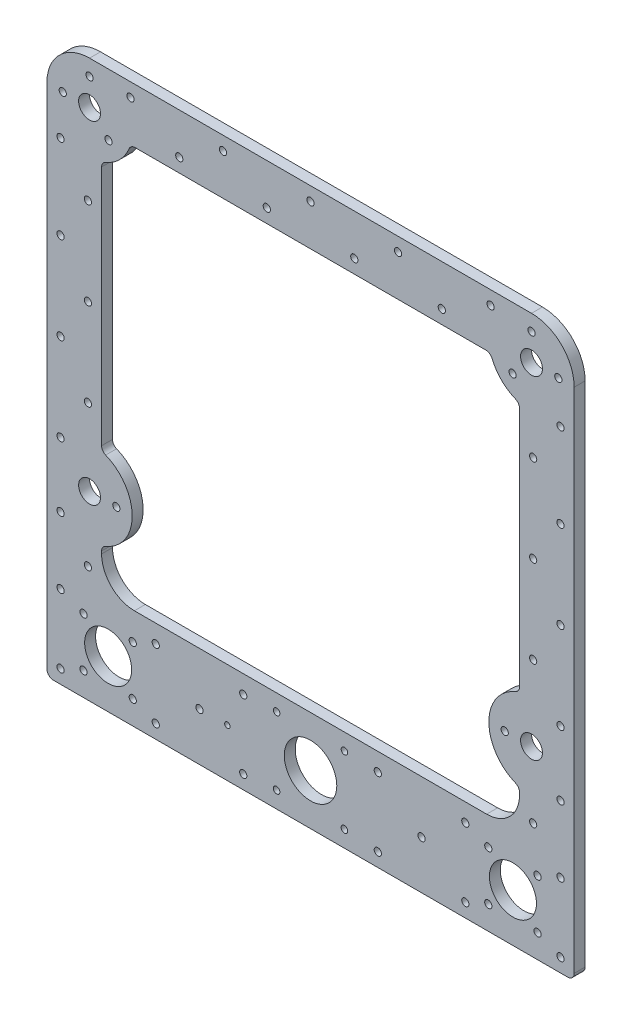
from build123d import *

# Parameters (mm, degrees)
CONVERT_SOLID1_START       = -5
CONVERT_SOLID1_OUTLINE_R   = 1.65
CONVERT_SOLID1_OUTLINE_R_2 = 10.75
CONVERT_SOLID1_OUTLINE_R_3 = 1.25
CONVERT_SOLID1_OUTLINE_R_4 = 1.5
CONVERT_SOLID1_OUTLINE_R_5 = 5
CONVERT_SOLID1_OUTLINE_R_6 = 12
CONVERT_SOLID1_DEPTH       = 5


# Read off the part's stored shape, not the designer's step: Convert-Solid1
with BuildPart() as part:
    # Convert-Solid1 outline → Convert-Solid1 (new body)
    with BuildSketch(Plane.XY.offset(CONVERT_SOLID1_START)):
        with BuildLine():
            ThreePointArc((19.5, 254.5), (5.711417767, 248.788582233), (0, 235))
            Line((0, 235), (0, 3))
            ThreePointArc((0, 3), (0.878679656, 0.878679656), (3, 0))
            Line((3, 0), (238, 0))
            ThreePointArc((238, 0), (240.121320344, 0.878679656), (241, 3))
            Line((241, 3), (241, 235))
            ThreePointArc((241, 235), (235.288582233, 248.788582233), (221.5, 254.5))
            Line((221.5, 254.5), (19.5, 254.5))
        make_face()
        with Locations((6.25, 6.25)):
            Circle(CONVERT_SOLID1_OUTLINE_R, mode=Mode.SUBTRACT)
        with Locations((16.75, 10.75)):
            Circle(CONVERT_SOLID1_OUTLINE_R, mode=Mode.SUBTRACT)
        with Locations((28, 22)):
            Circle(CONVERT_SOLID1_OUTLINE_R_2, mode=Mode.SUBTRACT)
        with Locations((39.25, 10.75)):
            Circle(CONVERT_SOLID1_OUTLINE_R, mode=Mode.SUBTRACT)
        with Locations((49.75, 6.25)):
            Circle(CONVERT_SOLID1_OUTLINE_R, mode=Mode.SUBTRACT)
        with Locations((6.25, 37.75)):
            Circle(CONVERT_SOLID1_OUTLINE_R, mode=Mode.SUBTRACT)
        with Locations((16.75, 33.25)):
            Circle(CONVERT_SOLID1_OUTLINE_R, mode=Mode.SUBTRACT)
        with Locations((18.75, 53)):
            Circle(CONVERT_SOLID1_OUTLINE_R, mode=Mode.SUBTRACT)
        with Locations((39.25, 33.25)):
            Circle(CONVERT_SOLID1_OUTLINE_R, mode=Mode.SUBTRACT)
        with Locations((49.75, 37.75)):
            Circle(CONVERT_SOLID1_OUTLINE_R, mode=Mode.SUBTRACT)
        with Locations((89.75, 6.25)):
            Circle(CONVERT_SOLID1_OUTLINE_R, mode=Mode.SUBTRACT)
        with Locations((69.75, 22)):
            Circle(CONVERT_SOLID1_OUTLINE_R, mode=Mode.SUBTRACT)
        with Locations((82.5, 22)):
            Circle(CONVERT_SOLID1_OUTLINE_R_3, mode=Mode.SUBTRACT)
        with Locations((105, 7.5)):
            Circle(CONVERT_SOLID1_OUTLINE_R_4, mode=Mode.SUBTRACT)
        with Locations((89.75, 37.75)):
            Circle(CONVERT_SOLID1_OUTLINE_R, mode=Mode.SUBTRACT)
        with Locations((105, 38.5)):
            Circle(CONVERT_SOLID1_OUTLINE_R_4, mode=Mode.SUBTRACT)
        with Locations((6.25, 68.25)):
            Circle(CONVERT_SOLID1_OUTLINE_R, mode=Mode.SUBTRACT)
        with Locations((19.5, 83)):
            Circle(CONVERT_SOLID1_OUTLINE_R_5, mode=Mode.SUBTRACT)
        with Locations((31.75, 83)):
            Circle(CONVERT_SOLID1_OUTLINE_R, mode=Mode.SUBTRACT)
        with Locations((6.25, 97.75)):
            Circle(CONVERT_SOLID1_OUTLINE_R, mode=Mode.SUBTRACT)
        with Locations((18.75, 117.75)):
            Circle(CONVERT_SOLID1_OUTLINE_R, mode=Mode.SUBTRACT)
        with Locations((136, 7.5)):
            Circle(CONVERT_SOLID1_OUTLINE_R_4, mode=Mode.SUBTRACT)
        with Locations((120.5, 23)):
            Circle(CONVERT_SOLID1_OUTLINE_R_6, mode=Mode.SUBTRACT)
        with Locations((151.25, 6.25)):
            Circle(CONVERT_SOLID1_OUTLINE_R, mode=Mode.SUBTRACT)
        with Locations((171.25, 22)):
            Circle(CONVERT_SOLID1_OUTLINE_R, mode=Mode.SUBTRACT)
        with Locations((136, 38.5)):
            Circle(CONVERT_SOLID1_OUTLINE_R_4, mode=Mode.SUBTRACT)
        with Locations((151.25, 37.75)):
            Circle(CONVERT_SOLID1_OUTLINE_R, mode=Mode.SUBTRACT)
        with Locations((191.25, 6.25)):
            Circle(CONVERT_SOLID1_OUTLINE_R, mode=Mode.SUBTRACT)
        with Locations((201.75, 10.75)):
            Circle(CONVERT_SOLID1_OUTLINE_R, mode=Mode.SUBTRACT)
        with Locations((224.25, 10.75)):
            Circle(CONVERT_SOLID1_OUTLINE_R, mode=Mode.SUBTRACT)
        with Locations((234.75, 6.25)):
            Circle(CONVERT_SOLID1_OUTLINE_R, mode=Mode.SUBTRACT)
        with Locations((213, 22)):
            Circle(CONVERT_SOLID1_OUTLINE_R_2, mode=Mode.SUBTRACT)
        with Locations((191.25, 37.75)):
            Circle(CONVERT_SOLID1_OUTLINE_R, mode=Mode.SUBTRACT)
        with Locations((201.75, 33.25)):
            Circle(CONVERT_SOLID1_OUTLINE_R, mode=Mode.SUBTRACT)
        with Locations((224.25, 33.25)):
            Circle(CONVERT_SOLID1_OUTLINE_R, mode=Mode.SUBTRACT)
        with Locations((234.75, 37.75)):
            Circle(CONVERT_SOLID1_OUTLINE_R, mode=Mode.SUBTRACT)
        with Locations((222.25, 53)):
            Circle(CONVERT_SOLID1_OUTLINE_R, mode=Mode.SUBTRACT)
        with Locations((209.25, 83)):
            Circle(CONVERT_SOLID1_OUTLINE_R, mode=Mode.SUBTRACT)
        with Locations((234.75, 68.25)):
            Circle(CONVERT_SOLID1_OUTLINE_R, mode=Mode.SUBTRACT)
        with Locations((221.5, 83)):
            Circle(CONVERT_SOLID1_OUTLINE_R_5, mode=Mode.SUBTRACT)
        with Locations((234.75, 97.75)):
            Circle(CONVERT_SOLID1_OUTLINE_R, mode=Mode.SUBTRACT)
        with Locations((222.25, 117.75)):
            Circle(CONVERT_SOLID1_OUTLINE_R, mode=Mode.SUBTRACT)
        with Locations((6.25, 137.75)):
            Circle(CONVERT_SOLID1_OUTLINE_R, mode=Mode.SUBTRACT)
        with Locations((18.75, 157.75)):
            Circle(CONVERT_SOLID1_OUTLINE_R, mode=Mode.SUBTRACT)
        with Locations((6.25, 177.75)):
            Circle(CONVERT_SOLID1_OUTLINE_R, mode=Mode.SUBTRACT)
        with Locations((18.75, 197.75)):
            Circle(CONVERT_SOLID1_OUTLINE_R, mode=Mode.SUBTRACT)
        with Locations((6.25, 216.291713066)):
            Circle(CONVERT_SOLID1_OUTLINE_R, mode=Mode.SUBTRACT)
        with Locations((7.25, 235)):
            Circle(CONVERT_SOLID1_OUTLINE_R, mode=Mode.SUBTRACT)
        with Locations((28.16205807, 226.33794193)):
            Circle(CONVERT_SOLID1_OUTLINE_R, mode=Mode.SUBTRACT)
        with Locations((19.5, 235)):
            Circle(CONVERT_SOLID1_OUTLINE_R_5, mode=Mode.SUBTRACT)
        with Locations((19.5, 247.25)):
            Circle(CONVERT_SOLID1_OUTLINE_R, mode=Mode.SUBTRACT)
        with Locations((38.208286934, 248.25)):
            Circle(CONVERT_SOLID1_OUTLINE_R, mode=Mode.SUBTRACT)
        with Locations((60.5, 235.75)):
            Circle(CONVERT_SOLID1_OUTLINE_R, mode=Mode.SUBTRACT)
        with Locations((80.5, 248.25)):
            Circle(CONVERT_SOLID1_OUTLINE_R, mode=Mode.SUBTRACT)
        with Locations((100.5, 235.75)):
            Circle(CONVERT_SOLID1_OUTLINE_R, mode=Mode.SUBTRACT)
        with BuildLine():
            Line((201, 46), (40, 46))
            ThreePointArc((40, 46), (29.393398282, 50.393398282), (25, 61))
            Line((25, 61), (25, 62.167333344))
            ThreePointArc((25, 62.167333344), (25.51002008, 63.840653397), (26.866666667, 64.945022231))
            ThreePointArc((26.866666667, 64.945022231), (39, 83), (26.866666667, 101.054977769))
            ThreePointArc((26.866666667, 101.054977769), (25.51002008, 102.159346603), (25, 103.832666656))
            Line((25, 103.832666656), (25, 214.167333344))
            ThreePointArc((25, 214.167333344), (25.51002008, 215.840653397), (26.866666667, 216.945022231))
            ThreePointArc((26.866666667, 216.945022231), (33.288582233, 221.211417767), (37.554977769, 227.633333333))
            ThreePointArc((37.554977769, 227.633333333), (38.659346603, 228.98997992), (40.332666656, 229.5))
            Line((40.332666656, 229.5), (200.667333344, 229.5))
            ThreePointArc((200.667333344, 229.5), (202.340653397, 228.98997992), (203.445022231, 227.633333333))
            ThreePointArc((203.445022231, 227.633333333), (207.711417767, 221.211417767), (214.133333333, 216.945022231))
            ThreePointArc((214.133333333, 216.945022231), (215.48997992, 215.840653397), (216, 214.167333344))
            Line((216, 214.167333344), (216, 103.832666656))
            ThreePointArc((216, 103.832666656), (215.48997992, 102.159346603), (214.133333333, 101.054977769))
            ThreePointArc((214.133333333, 101.054977769), (202, 83), (214.133333333, 64.945022231))
            ThreePointArc((214.133333333, 64.945022231), (215.48997992, 63.840653397), (216, 62.167333344))
            Line((216, 62.167333344), (216, 61))
            ThreePointArc((216, 61), (211.606601718, 50.393398282), (201, 46))
        make_face(mode=Mode.SUBTRACT)
        with Locations((234.75, 137.75)):
            Circle(CONVERT_SOLID1_OUTLINE_R, mode=Mode.SUBTRACT)
        with Locations((222.25, 157.75)):
            Circle(CONVERT_SOLID1_OUTLINE_R, mode=Mode.SUBTRACT)
        with Locations((234.75, 177.75)):
            Circle(CONVERT_SOLID1_OUTLINE_R, mode=Mode.SUBTRACT)
        with Locations((140.5, 235.75)):
            Circle(CONVERT_SOLID1_OUTLINE_R, mode=Mode.SUBTRACT)
        with Locations((120.5, 248.25)):
            Circle(CONVERT_SOLID1_OUTLINE_R, mode=Mode.SUBTRACT)
        with Locations((180.5, 235.75)):
            Circle(CONVERT_SOLID1_OUTLINE_R, mode=Mode.SUBTRACT)
        with Locations((160.5, 248.25)):
            Circle(CONVERT_SOLID1_OUTLINE_R, mode=Mode.SUBTRACT)
        with Locations((222.25, 197.75)):
            Circle(CONVERT_SOLID1_OUTLINE_R, mode=Mode.SUBTRACT)
        with Locations((234.75, 216.291713066)):
            Circle(CONVERT_SOLID1_OUTLINE_R, mode=Mode.SUBTRACT)
        with Locations((202.791713066, 248.25)):
            Circle(CONVERT_SOLID1_OUTLINE_R, mode=Mode.SUBTRACT)
        with Locations((212.83794193, 226.33794193)):
            Circle(CONVERT_SOLID1_OUTLINE_R, mode=Mode.SUBTRACT)
        with Locations((221.5, 235)):
            Circle(CONVERT_SOLID1_OUTLINE_R_5, mode=Mode.SUBTRACT)
        with Locations((233.75, 235)):
            Circle(CONVERT_SOLID1_OUTLINE_R, mode=Mode.SUBTRACT)
        with Locations((221.5, 247.25)):
            Circle(CONVERT_SOLID1_OUTLINE_R, mode=Mode.SUBTRACT)
    extrude(amount=CONVERT_SOLID1_DEPTH)


solid = part.part
